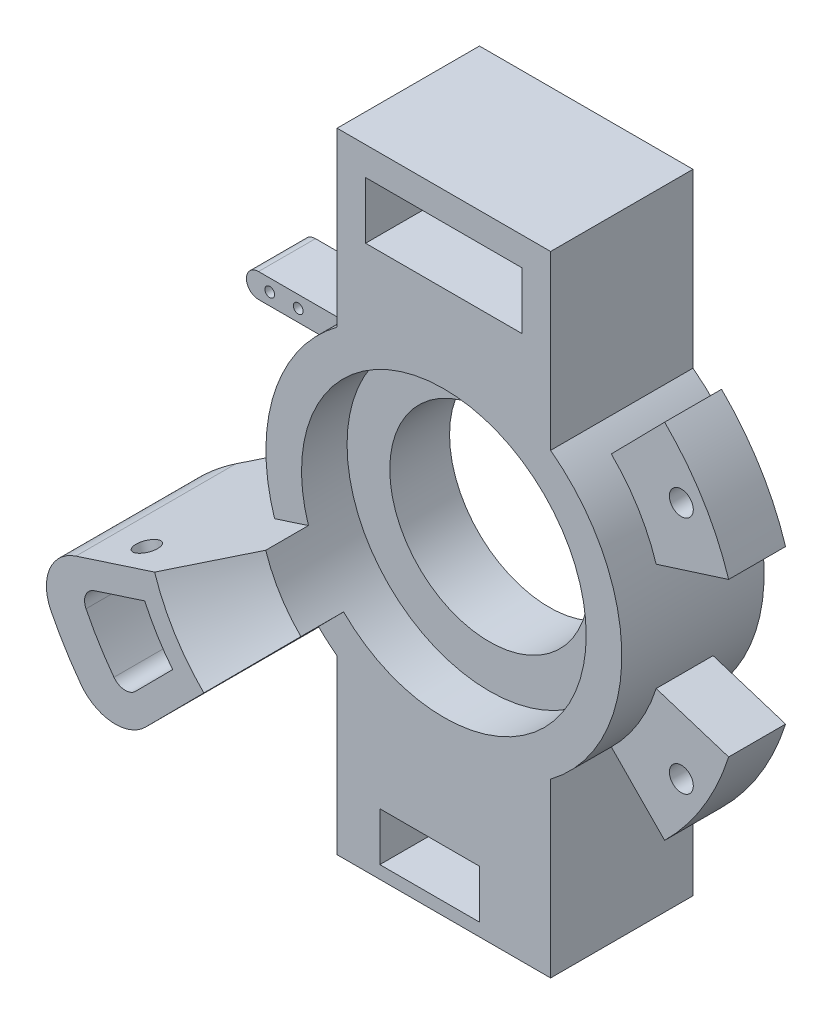
from build123d import *

# Parameters (mm, degrees)
SKETCH1_W                          = 75
SKETCH1_H                          = 50.00000000000001
BE_MAIN_UPRIGHT_BODY_DEPTH         = 221
SKETCH19_R                         = 62.5
BOSS_EXTRUDE1_DEPTH                = 50
SKETCH4_R                          = 35
CE_THROUGH_HOLE_DEPTH              = 236.04733565816056
SKETCH2_R                          = 50
CE_INNER_BEARING_DEPTH             = 16
SKETCH3_R                          = 55
CE_OUTER_BEARING_DEPTH             = 13
BE_CALIPER_MOUNT_V2_DEPTH          = 10
BE_TIE_ROD_MOUNT_V2_DEPTH          = 60.00000000000001
BE_TIE_ROD_MOUNT_V2_DEPTH_BACK     = 9.999999999999996
SKETCH32_R                         = 1.7000000000000146
BE_TEMP_SENSOR_MOUNT_V3_DEPTH      = 10
CE_CALIPER_HOLES_REACH             = 255.863
SKETCH26_R                         = 4.199999999999994
SKETCH26_R_2                       = 4.1999999999999975
CE_CALIPER_HOLES_DIRECTION_2_REACH = 255.863
SKETCH12_R                         = 4.0000000000000036
SKETCH12_R_2                       = 4
CE_TOP_CLEVIS_HOLES_DEPTH          = 252.68750278067682
CE_TOP_CLEVIS_SPACE_DEPTH          = 35
CE_BOTTOM_CLEVIS_SPACE_DEPTH       = 252.68750278067682
SKETCH15_W                         = 25.000000000000004
SKETCH15_H                         = 5
CE_EXPAND_BOTTOM_CLEVIS_DEPTH      = 252.68750278067682
CE_WIDEN_BOTTOM_CLEVIS_DEPTH       = 249.87031277664735
CE_WIDEN_BOTTOM_CLEVIS_DEPTH_BACK  = 249.87031277664735
SKETCH16_W                         = 10.00755403153164
SKETCH16_H                         = 17
CHAMFER1_SIZE                      = 20
CHAMFER2_SIZE                      = 30
CUT_EXTRUDE1_REACH                 = 180.963
SKETCH28_R                         = 4.000000000000007
CUT_EXTRUDE2_REACH                 = 262.905
FILLET2_R                          = 15
FILLET3_R                          = 5


with BuildPart() as part:
    # Sketch1 → BE - main upright body (new body)
    with BuildSketch(Plane(origin=(0, 0, 0), x_dir=(1, 0, 0), z_dir=(0, 1, 0))):
        Rectangle(SKETCH1_W, SKETCH1_H)
    extrude(amount=BE_MAIN_UPRIGHT_BODY_DEPTH)

    # Sketch19 → Boss-Extrude1 (add)
    with BuildSketch(Plane.XY.offset(25)):
        with Locations((0, 110.5)):
            Circle(SKETCH19_R)
    extrude(amount=-BOSS_EXTRUDE1_DEPTH)

    # Sketch4 → CE - Through hole (cut, through all)
    with BuildSketch(Plane.XY.offset(25)):
        with Locations((6.57e-15, 110.5)):
            Circle(SKETCH4_R)
    extrude(amount=-CE_THROUGH_HOLE_DEPTH, mode=Mode.SUBTRACT)

    # Sketch2 → CE - Inner bearing (cut)
    with BuildSketch(Plane.XY.offset(25)):
        with Locations((5.2e-15, 110.5)):
            Circle(SKETCH2_R)
    extrude(amount=-CE_INNER_BEARING_DEPTH, mode=Mode.SUBTRACT)

    # Sketch3 → CE - Outer bearing (cut)
    with BuildSketch(Plane(origin=(0, 0, -25), x_dir=(-1, 0, 0), z_dir=(0, 0, -1))):
        with Locations((0, 110.5)):
            Circle(SKETCH3_R)
    extrude(amount=-CE_OUTER_BEARING_DEPTH, mode=Mode.SUBTRACT)

    # Sketch23 → BE - caliper mount v2 (add, symmetric)
    with BuildSketch(Plane.XY):
        with BuildLine():
            Line((35.05710874811726, 146.15107468538196), (62.54897572629606, 174.1087311459216))
            ThreePointArc((62.54897572629606, 174.1087311459216), (76.02582114581824, 157.1746136728197), (85.02821067036592, 137.4934887074417))
            Line((85.02821067036592, 137.4934887074417), (47.65614773889368, 125.62916331753813))
            ThreePointArc((47.65614773889368, 125.62916331753813), (42.610537560783285, 136.65993288946052), (35.05710874811726, 146.15107468538196))
        make_face()
        with BuildLine():
            Line((35.05710874811726, 74.84892531461804), (62.54897572629606, 46.89126885407838))
            ThreePointArc((62.54897572629606, 46.89126885407838), (76.02582114581824, 63.82538632718028), (85.02821067036592, 83.50651129255829))
            Line((85.02821067036592, 83.50651129255829), (47.65614773889368, 95.37083668246188))
            ThreePointArc((47.65614773889368, 95.37083668246188), (42.61053756078329, 84.34006711053948), (35.05710874811726, 74.84892531461804))
        make_face()
    extrude(amount=BE_CALIPER_MOUNT_V2_DEPTH, both=True)

    # Sketch24 → BE - tie rod mount v2 (add, two sides: drawn at the far end of the back side and taken through both)
    with BuildSketch(Plane.XY.offset(-BE_TIE_ROD_MOUNT_V2_DEPTH_BACK)):
        with BuildLine():
            Line((-35.21675994796843, 75.00662288866886), (-81.12210695526274, 28.74070304926003))
            ThreePointArc((-81.12210695526274, 28.74070304926003), (-98.11223118223046, 50.172817344210976), (-109.57006459783258, 75.00662288866886))
            Line((-109.57006459783258, 75.00662288866886), (-47.56659814757113, 95.0916016190039))
            ThreePointArc((-47.56659814757113, 95.0916016190039), (-42.592519144130065, 84.31074050384561), (-35.21675994796843, 75.00662288866886))
        make_face()
    extrude(amount=BE_TIE_ROD_MOUNT_V2_DEPTH + BE_TIE_ROD_MOUNT_V2_DEPTH_BACK)

    # Sketch32 → BE - temp sensor mount v3 (add, symmetric)
    with BuildSketch(Plane.XY):
        with BuildLine():
            Line((-40.308968964609726, 148.60437176531212), (-80.09470245298189, 148.60437176531215))
            ThreePointArc((-80.09470245298189, 148.60437176531215), (-84.35510834631509, 144.34396587197895), (-80.09470245298189, 140.08355997864578))
            Line((-80.09470245298189, 140.08355997864578), (-40.30896896460972, 140.08355997864575))
            Line((-40.30896896460972, 140.08355997864575), (-40.308968964609726, 148.60437176531212))
        make_face()
        with Locations((-76.1523345656343, 144.34396587197895)):
            Circle(SKETCH32_R, mode=Mode.SUBTRACT)
        with Locations((-66.1523345656343, 144.34396587197895)):
            Circle(SKETCH32_R, mode=Mode.SUBTRACT)
    extrude(amount=BE_TEMP_SENSOR_MOUNT_V3_DEPTH, both=True)

    # Sketch26 → CE - caliper holes (cut, up to next)
    with BuildSketch(Plane.XY, mode=Mode.PRIVATE) as ce_caliper_holes_sk1:
        with Locations(Location((68.41158901726085, 68.50000000000001, 0), (0, 0, 180))):
            Circle(SKETCH26_R)
    ce_caliper_holes_tool1 = extrude(ce_caliper_holes_sk1.sketch, amount=-CE_CALIPER_HOLES_REACH, mode=Mode.PRIVATE) & part.part
    # Sketch26 → CE - caliper holes (cut, up to next)
    with BuildSketch(Plane.XY, mode=Mode.PRIVATE) as ce_caliper_holes_sk2:
        with Locations(Location((68.41158901726085, 152.49999999999997, 0), (0, 0, 180))):
            Circle(SKETCH26_R_2)
    ce_caliper_holes_tool2 = extrude(ce_caliper_holes_sk2.sketch, amount=-CE_CALIPER_HOLES_REACH, mode=Mode.PRIVATE) & part.part
    add(ce_caliper_holes_tool1.solids().sort_by_distance((68.411589, 68.5, 0))[0], mode=Mode.SUBTRACT)
    add(ce_caliper_holes_tool2.solids().sort_by_distance((68.411589, 152.5, 0))[0], mode=Mode.SUBTRACT)

    # Sketch26 → CE - caliper holes direction 2 (cut, up to next)
    with BuildSketch(Plane.XY, mode=Mode.PRIVATE) as ce_caliper_holes_direction_2_sk1:
        with Locations(Location((68.41158901726085, 68.50000000000001, 0), (0, 0, 180))):
            Circle(SKETCH26_R)
    ce_caliper_holes_direction_2_tool1 = extrude(ce_caliper_holes_direction_2_sk1.sketch, amount=CE_CALIPER_HOLES_DIRECTION_2_REACH, mode=Mode.PRIVATE) & part.part
    # Sketch26 → CE - caliper holes direction 2 (cut, up to next)
    with BuildSketch(Plane.XY, mode=Mode.PRIVATE) as ce_caliper_holes_direction_2_sk2:
        with Locations(Location((68.41158901726085, 152.49999999999997, 0), (0, 0, 180))):
            Circle(SKETCH26_R_2)
    ce_caliper_holes_direction_2_tool2 = extrude(ce_caliper_holes_direction_2_sk2.sketch, amount=CE_CALIPER_HOLES_DIRECTION_2_REACH, mode=Mode.PRIVATE) & part.part
    add(ce_caliper_holes_direction_2_tool1.solids().sort_by_distance((68.411589, 68.5, 0))[0], mode=Mode.SUBTRACT)
    add(ce_caliper_holes_direction_2_tool2.solids().sort_by_distance((68.411589, 152.5, 0))[0], mode=Mode.SUBTRACT)

    # Sketch12 → CE - top clevis holes (cut, through all)
    with BuildSketch(Plane.XY.offset(25)):
        with Locations((-12.5, 201)):
            Circle(SKETCH12_R)
        with Locations((12.5, 201)):
            Circle(SKETCH12_R_2)
    extrude(amount=-CE_TOP_CLEVIS_HOLES_DEPTH, mode=Mode.SUBTRACT)

    # Sketch13 → CE - top clevis space (cut)
    with BuildSketch(Plane.XY.offset(25)):
        Polygon((-27.499999999999968, 191.00000000000006), (27.500000000000032, 191.00000000000006), (27.500000000000032, 211.00000000000003), (-27.499999999999968, 211.00000000000006), align=None)
    extrude(amount=-CE_TOP_CLEVIS_SPACE_DEPTH, mode=Mode.SUBTRACT)

    # Sketch14 → CE - bottom clevis space (cut, through all)
    with BuildSketch(Plane.XY.offset(25)):
        Polygon((-22.48000000000002, 4.500000000000011), (2.5199999999999796, 4.500000000000011), (2.51999999999998, 16.50000000000001), (-22.48000000000002, 16.50000000000001), align=None)
    extrude(amount=-CE_BOTTOM_CLEVIS_SPACE_DEPTH, mode=Mode.SUBTRACT)

    # Sketch15 → CE - expand bottom clevis (cut, through all)
    with BuildSketch(Plane.XY.offset(25)):
        with Locations((-9.98000000000002, 19.00000000000001)):
            Rectangle(SKETCH15_W, SKETCH15_H)
    extrude(amount=-CE_EXPAND_BOTTOM_CLEVIS_DEPTH, mode=Mode.SUBTRACT)

    # Sketch16 → CE - widen bottom clevis (cut, two sides: drawn at the far end of the back side and taken through both)
    with BuildSketch(Plane(origin=(2.5199999999999796, 4.500000000000011, 25), x_dir=(1, 0, 0), z_dir=(0, 0, 1)).offset(-CE_WIDEN_BOTTOM_CLEVIS_DEPTH_BACK)):
        with Locations((5.00377701576582, 8.5)):
            Rectangle(SKETCH16_W, SKETCH16_H)
    extrude(amount=CE_WIDEN_BOTTOM_CLEVIS_DEPTH + CE_WIDEN_BOTTOM_CLEVIS_DEPTH_BACK, mode=Mode.SUBTRACT)

    # Chamfer1
    chamfer1_edges = [part.edges().sort_by_distance(p)[0] for p in [
        (-42.592519144130065, 84.31074050384561, 60.00000000000001),
    ]]
    chamfer(chamfer1_edges, length=CHAMFER1_SIZE)

    # Chamfer2
    chamfer2_edges = [part.edges().sort_by_distance(p)[0] for p in [
        (-98.11223118223045, 50.17281734421098, -9.999999999999996),
    ]]
    chamfer(chamfer2_edges, length=CHAMFER2_SIZE)

    # Cut-Extrude1: up to this plane
    cut_extrude1_end = Plane(origin=(-35.21675994796843, 75.00662288866886, -9.999999999999996), z_dir=(0.7098675422266223, -0.7043351989593695, 0))
    # Sketch28 → Cut-Extrude1 (cut, up to the surface)
    with BuildSketch(Plane(origin=(-32.39528914978471, 100.00609166249728, 0), x_dir=(0.951331962951422, 0.3081679676199239, 0), z_dir=(-0.3081679676199238, 0.9513319629514219, 0)), mode=Mode.PRIVATE) as cut_extrude1_sk1:
        with Locations(Location((-50.230429584814566, -49.15, 0), (0, 0, 180))):
            Circle(SKETCH28_R)
    cut_extrude1_tool1 = split(extrude(cut_extrude1_sk1.sketch, amount=-CUT_EXTRUDE1_REACH, mode=Mode.PRIVATE), bisect_by=cut_extrude1_end, keep=Keep.BOTH, mode=Mode.PRIVATE)
    add(cut_extrude1_tool1.solids().sort_by_distance((-80.181102, 84.526682, 49.15))[0], mode=Mode.SUBTRACT)

    # Sketch29 → Cut-Extrude2 (cut, up to next)
    with BuildSketch(Plane.XY.offset(60.00000000000001), mode=Mode.PRIVATE) as cut_extrude2_sk1:
        with BuildLine():
            Line((-70.0705275210271, 78.4190759215617), (-93.07971814036846, 70.96563612779761))
            ThreePointArc((-93.07971814036846, 70.96563612779761), (-86.14562004973435, 57.53083914090252), (-77.28611251700346, 45.279936615492176))
            Line((-77.28611251700346, 45.279936615492176), (-60.250857228734134, 62.4489987616883))
            ThreePointArc((-60.250857228734134, 62.4489987616883), (-65.64812771052121, 70.13432343060958), (-70.0705275210271, 78.4190759215617))
        make_face()
    cut_extrude2_tool1 = extrude(cut_extrude2_sk1.sketch, amount=-CUT_EXTRUDE2_REACH, mode=Mode.PRIVATE) & part.part
    add(cut_extrude2_tool1.solids().sort_by_distance((-76.449162, 63.492991, 60))[0], mode=Mode.SUBTRACT)

    # Fillet2
    # the kernel refuses this fillet: 15 mm, written as the material it takes off along each edge
    with BuildSketch(Plane(origin=(-81.12210695526272, 28.740703049260055, -23.23718779420447), x_dir=(0.70433519895937, 0.7098675422266219, 0), z_dir=(0, 0, 1))) as fillet2_piece_1:
        with BuildLine():
            CenterArc((16.129396420502527, 15.000000000000002), FILLET2_R, 171.38829576022673, 98.6117042397733)
            ThreePointArc((1.2985092148828912, 17.246059815362816), (0.3250860863217871, 8.647437558840888), (0, 0))
            Line((0, 0), (16.12939642050253, 3.6e-16))
        make_face()
    extrude(amount=126.47437558840895, mode=Mode.SUBTRACT)
    with BuildSketch(Plane(origin=(-109.57006459783257, 75.00662288866886, 103.23718779420446), x_dir=(0.3787247076655996, -0.9255093709971856, 0), z_dir=(0, 0, -1))) as fillet2_piece_2:
        with BuildLine():
            CenterArc((16.16866645235697, -14.957662051341691), FILLET2_R, 85.69414788011332, 98.61170423977336)
            Line((1.2110044010152803, -16.083870716666514), (0, 0))
            ThreePointArc((0, 0), (8.6474375588409, 0.3250860863217989), (17.29487511768179, -4.5e-16))
        make_face()
    extrude(amount=126.47437558840892, mode=Mode.SUBTRACT)

    # Fillet3
    fillet3_edges = [part.edges().sort_by_distance(p)[0] for p in [
        (-77.28611251700346, 45.279936615492176, 32.976107440368864),
        (-93.07971814036846, 70.96563612779761, 32.976107440368864),
    ]]
    fillet(fillet3_edges, radius=FILLET3_R)


solid = part.part
